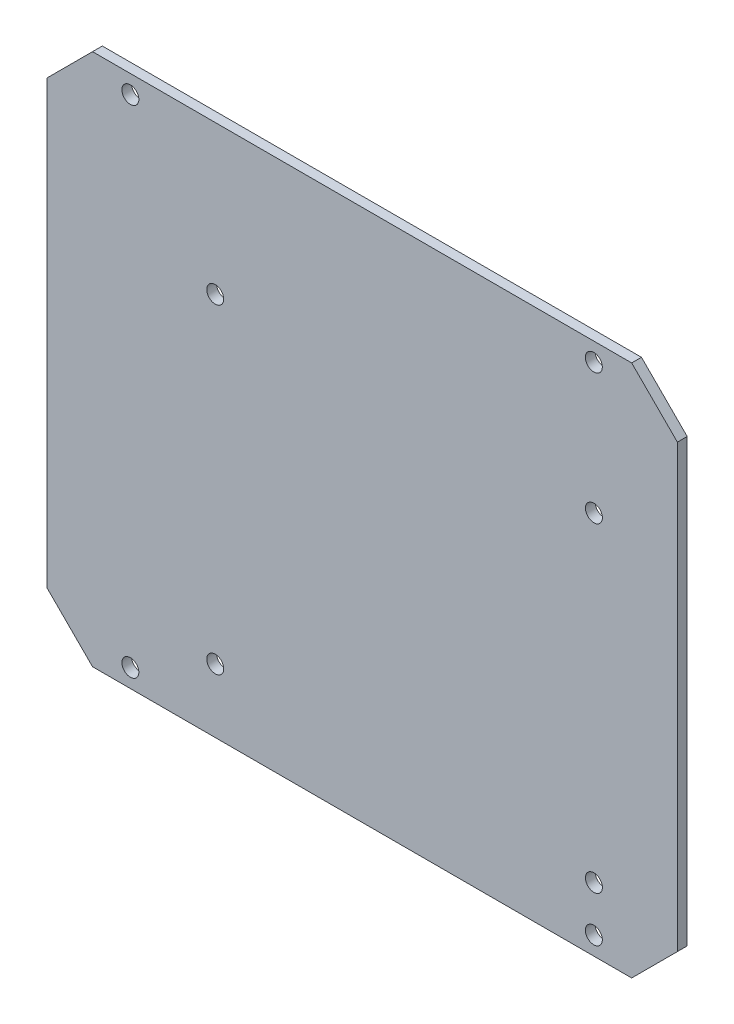
from build123d import *

# Parameters (mm, degrees)
EXTRUDE_1_DEPTH     = 1.5
SKETCH_3_R          = 1.3
CUT_EXTRUDE_1_DEPTH = 65.139634718
CUT_EXTRUDE_2_REACH = 66.14
SKETCH_4_R          = 1.3


with BuildPart() as part:
    # 草图2 → 凸台-拉伸1 (new body)
    with BuildSketch(Plane(origin=(0, 0, -39), x_dir=(-1, 0, 0), z_dir=(0, 0, -1))):
        Polygon((-47.34673203, -34.053824425), (-40.342568974, -41.057987481), (42.249104914, -41.057987481), (49.25326797, -34.053824425), (49.25326797, 33.537849463), (42.249104914, 40.542012519), (-40.342568974, 40.542012519), (-47.34673203, 33.537849463), align=None)
    extrude(amount=EXTRUDE_1_DEPTH)

    # 草图3 → 切除-拉伸1 (cut, through all)
    with BuildSketch(Plane(origin=(0, 0, -40.5), x_dir=(-1, 0, 0), z_dir=(0, 0, -1))):
        with Locations((-34.54673203, -38.257987481)):
            Circle(SKETCH_3_R)
        with Locations((36.45326797, -38.257987481)):
            Circle(SKETCH_3_R)
        with Locations((-34.54673203, 37.742012519)):
            Circle(SKETCH_3_R)
        with Locations((36.45326797, 37.742012519)):
            Circle(SKETCH_3_R)
    extrude(amount=-CUT_EXTRUDE_1_DEPTH, mode=Mode.SUBTRACT)

    # 草图4 → 切除-拉伸2 (cut, up to next)
    with BuildSketch(Plane(origin=(0, 0, -40.5), x_dir=(-1, 0, 0), z_dir=(0, 0, -1)), mode=Mode.PRIVATE) as cut_extrude_2_sk1:
        with Locations((23.45326797, -31.293200074)):
            Circle(SKETCH_4_R)
    cut_extrude_2_tool1 = extrude(cut_extrude_2_sk1.sketch, amount=-CUT_EXTRUDE_2_REACH, mode=Mode.PRIVATE) & part.part
    # 草图4 → 切除-拉伸2 (cut, up to next)
    with BuildSketch(Plane(origin=(0, 0, -40.5), x_dir=(-1, 0, 0), z_dir=(0, 0, -1)), mode=Mode.PRIVATE) as cut_extrude_2_sk2:
        with Locations((-34.558299802, -31.293200074)):
            Circle(SKETCH_4_R)
    cut_extrude_2_tool2 = extrude(cut_extrude_2_sk2.sketch, amount=-CUT_EXTRUDE_2_REACH, mode=Mode.PRIVATE) & part.part
    # 草图4 → 切除-拉伸2 (cut, up to next)
    with BuildSketch(Plane(origin=(0, 0, -40.5), x_dir=(-1, 0, 0), z_dir=(0, 0, -1)), mode=Mode.PRIVATE) as cut_extrude_2_sk3:
        with Locations((23.45326797, 17.742012519)):
            Circle(SKETCH_4_R)
    cut_extrude_2_tool3 = extrude(cut_extrude_2_sk3.sketch, amount=-CUT_EXTRUDE_2_REACH, mode=Mode.PRIVATE) & part.part
    # 草图4 → 切除-拉伸2 (cut, up to next)
    with BuildSketch(Plane(origin=(0, 0, -40.5), x_dir=(-1, 0, 0), z_dir=(0, 0, -1)), mode=Mode.PRIVATE) as cut_extrude_2_sk4:
        with Locations((-34.558299802, 17.742012519)):
            Circle(SKETCH_4_R)
    cut_extrude_2_tool4 = extrude(cut_extrude_2_sk4.sketch, amount=-CUT_EXTRUDE_2_REACH, mode=Mode.PRIVATE) & part.part
    add(cut_extrude_2_tool1.solids().sort_by_distance((-23.453268, -31.2932, -40.5))[0], mode=Mode.SUBTRACT)
    add(cut_extrude_2_tool2.solids().sort_by_distance((34.5583, -31.2932, -40.5))[0], mode=Mode.SUBTRACT)
    add(cut_extrude_2_tool3.solids().sort_by_distance((-23.453268, 17.742013, -40.5))[0], mode=Mode.SUBTRACT)
    add(cut_extrude_2_tool4.solids().sort_by_distance((34.5583, 17.742013, -40.5))[0], mode=Mode.SUBTRACT)


solid = part.part
